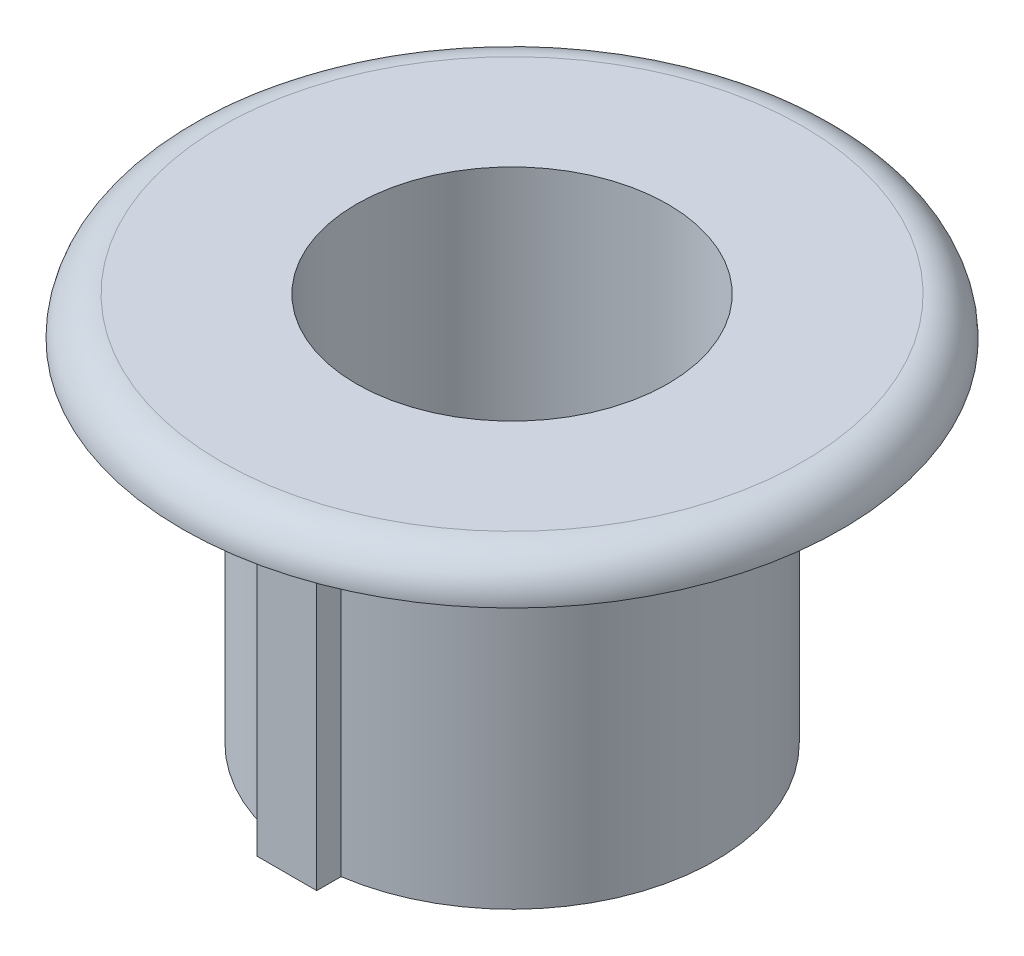
from build123d import *

# Parameters (mm, degrees)
FILLET1_R           = 1.524
BOSS_EXTRUDE1_START = -13.716
BOSS_EXTRUDE1_DEPTH = 13.716


with BuildPart() as part:
    # Sketch1 → Base-Revolve (revolve)
    with BuildSketch(Plane.XY, mode=Mode.PRIVATE) as base_revolve_sk:
        Polygon((10.414, 39.386322837), (9.6266, 39.386322837), (9.6266, 40.910322837), (7.9502, 40.910322837), (7.9502, 27.194322837), (6.096, 27.194322837), (6.096, 42.434322837), (12.9032, 42.434322837), (12.9032, 40.910322837), (10.414, 40.910322837), align=None)
    revolve(base_revolve_sk.sketch.rotate(Axis((0, 42.434322837, 0), (0, -1, 0)), 90), axis=Axis((0, 42.434322837, 0), (0, -1, 0)))

    # Fillet1
    fillet1_edges = [part.edges().sort_by_distance(p)[0] for p in [
        (0, 42.434322837, -12.9032),
    ]]
    fillet(fillet1_edges, radius=FILLET1_R - 0.0001)  # a hair under: the kernel refuses the full size

    # Sketch3 → Boss-Extrude1 (add)
    with BuildSketch(Plane.XZ.offset(-27.194322837).offset(BOSS_EXTRUDE1_START)):
        with BuildLine():
            Line((-1.166541413, 7.864150378), (-1.166541413, 8.8138))
            Line((-1.166541413, 8.8138), (1.166541413, 8.8138))
            Line((1.166541413, 8.8138), (1.166541413, 7.864150378))
            ThreePointArc((1.166541413, 7.864150378), (0, 7.9502), (-1.166541413, 7.864150378))
        make_face()
    extrude(amount=BOSS_EXTRUDE1_DEPTH)


solid = part.part
